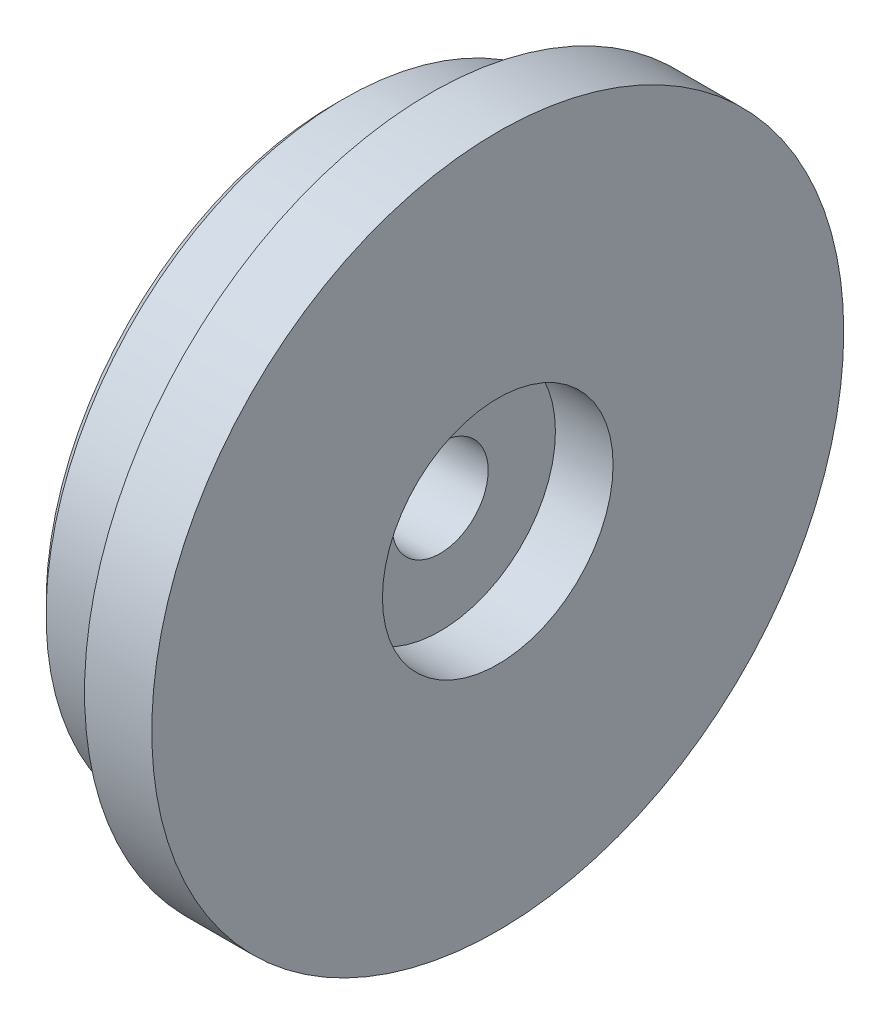
from build123d import *


with BuildPart() as part:
    # Esquisse1 → Révolution1789 (revolve)
    with BuildSketch(Plane.XY):
        Polygon((0, 18), (-3.5, 18), (-3.5, 15), (-4.5, 15), (-4.5, 15.5), (-8, 15.5), (-8.5, 15), (-8.5, 12), (-5.75, 12), (-5, 11.25), (-5, 5.75), (-5.75, 5), (-8.5, 5), (-8.5, 2.5), (-3, 2.5), (-3, 6), (0, 6), align=None)
    revolve(axis=Axis((0, 0, 0), (-1, 0, 0)))


solid = part.part
